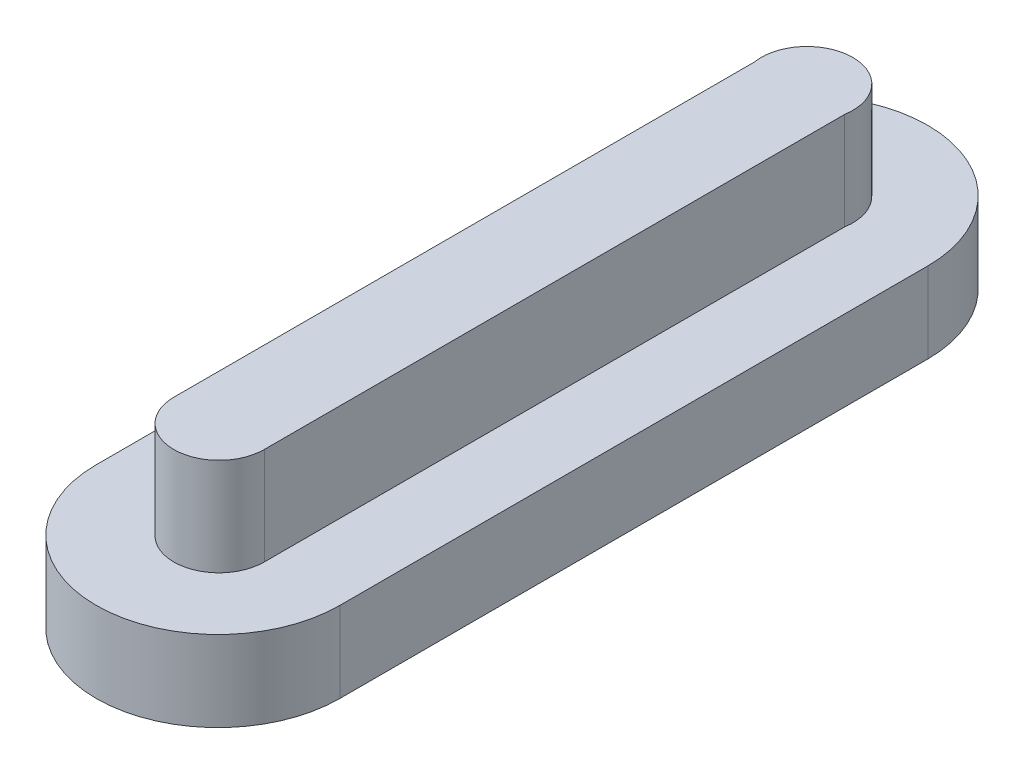
from build123d import *

# Parameters (mm, degrees)
BOSS_EXTRUDE1_DEPTH = 4.8
BOSS_EXTRUDE2_DEPTH = 5.8
BOSS_EXTRUDE3_DEPTH = 8.1
SKETCH6_W           = 47.962876405
SKETCH6_H           = 102.306106239
CUT_EXTRUDE2_DEPTH  = 8.1


with BuildPart() as part:
    # Sketch1 → Boss-Extrude1 (new body)
    with BuildSketch(Plane(origin=(0, 0, 0), x_dir=(1, 0, 0), z_dir=(0, 1, 0))):
        with BuildLine():
            Line((7.25, 0), (7.25, -35))
            ThreePointArc((7.25, -35), (0, -42.25), (-7.25, -35))
            Line((-7.25, -35), (-7.25, 0))
            ThreePointArc((-7.25, 0), (0, 7.25), (7.25, 0))
        make_face()
    extrude(amount=BOSS_EXTRUDE1_DEPTH)

    # Sketch3 → Boss-Extrude2 (add)
    with BuildSketch(Plane(origin=(0, 4.8, 0), x_dir=(1, 0, 0), z_dir=(0, 1, 0))):
        with BuildLine():
            Line((-2.622571491, -0.457666807), (-2.622571491, -35.011296081))
            ThreePointArc((-2.622571491, -35.011296081), (0.070610389, -37.704477961), (2.763792269, -35.011296081))
            Line((2.763792269, -35.011296081), (2.763792269, -0.457666807))
            ThreePointArc((2.763792269, -0.457666807), (0.070610389, 2.718626164), (-2.622571491, -0.457666807))
        make_face()
    extrude(amount=BOSS_EXTRUDE2_DEPTH)

    # Sketch4 → Boss-Extrude3 (add)
    with BuildSketch(Plane(origin=(0, 10.6, 0), x_dir=(1, 0, 0), z_dir=(0, 1, 0))):
        with BuildLine():
            Line((7.25308141, 0.014627933), (7.323691799, -34.996668148))
            ThreePointArc((7.323691799, -34.996668148), (0.085238322, -42.264377491), (-7.182471021, -35.025924014))
            Line((-7.182471021, -35.025924014), (-7.25308141, -0.014627933))
            ThreePointArc((-7.25308141, -0.014627933), (-0.014627933, 7.25308141), (7.25308141, 0.014627933))
        make_face()
    extrude(amount=BOSS_EXTRUDE3_DEPTH)

    # Sketch6 → Cut-Extrude2 (cut)
    with BuildSketch(Plane(origin=(0, 18.7, 0), x_dir=(1, 0, 0), z_dir=(0, 1, 0))):
        with Locations((-0.598314531, -14.694331718)):
            Rectangle(SKETCH6_W, SKETCH6_H)
    extrude(amount=-CUT_EXTRUDE2_DEPTH, mode=Mode.SUBTRACT)


solid = part.part
